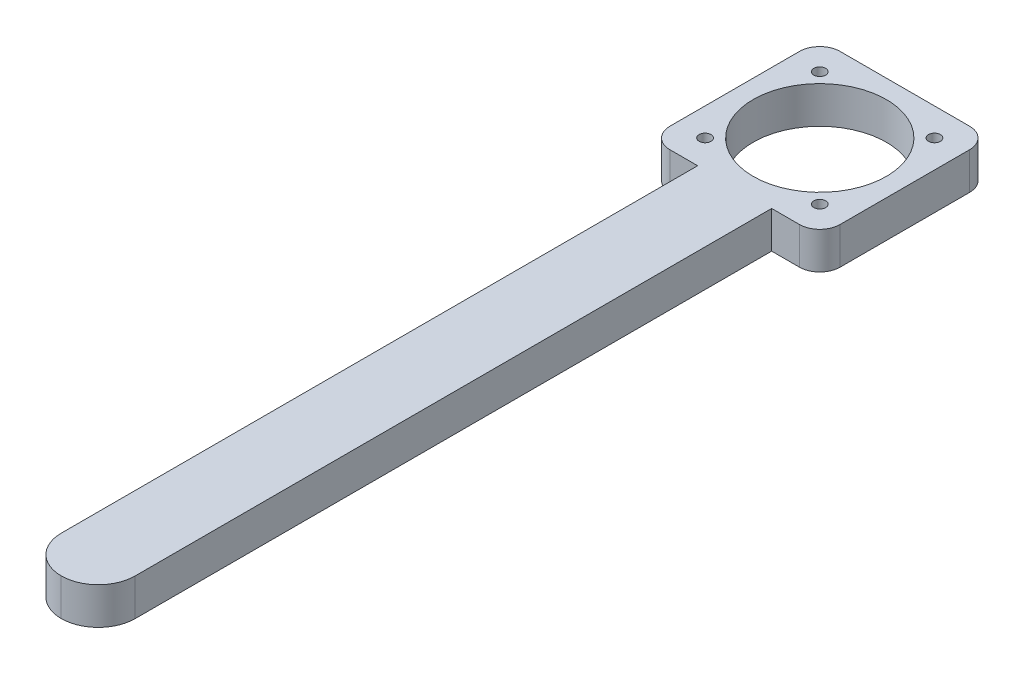
from build123d import *

# Parameters (mm, degrees)
SKETCH_2_W          = 46
SKETCH_2_H          = 46
SKETCH_2_R          = 18
EXTRUDE_1_DEPTH     = 10
FILLET_1_R          = 5.5
SKETCH_3_R          = 1.6
CUT_EXTRUDE_1_DEPTH = 35.029399054
SKETCH_4_W          = 20
SKETCH_4_H          = 182
EXTRUDE_2_DEPTH     = 10
FILLET_2_R          = 10


with BuildPart() as part:
    # 草图2 → 凸台-拉伸1 (new body)
    with BuildSketch(Plane(origin=(0, 0, 0), x_dir=(1, 0, 0), z_dir=(0, 1, 0))):
        Rectangle(SKETCH_2_W, SKETCH_2_H)
        with Locations(Location((0, 0, 0), (0, 0, 270))):
            Circle(SKETCH_2_R, mode=Mode.SUBTRACT)
    extrude(amount=EXTRUDE_1_DEPTH)

    # 圆角1
    fillet_1_edges = [part.edges().sort_by_distance(p)[0] for p in [
        (23, 5, 23),
        (-23, 5, 23),
        (-23, 5, -23),
        (23, 5, -23),
    ]]
    fillet(fillet_1_edges, radius=FILLET_1_R)

    # 草图3 → 切除-拉伸1 (cut, through all)
    with BuildSketch(Plane(origin=(0, 10, 0), x_dir=(1, 0, 0), z_dir=(0, 1, 0))):
        with Locations(Location((-15.5, 15.5, 0), (0, 0, 270))):
            Circle(SKETCH_3_R)
        with Locations(Location((15.5, 15.5, 0), (0, 0, 270))):
            Circle(SKETCH_3_R)
        with Locations(Location((-15.5, -15.5, 0), (0, 0, 270))):
            Circle(SKETCH_3_R)
        with Locations(Location((15.5, -15.5, 0), (0, 0, 270))):
            Circle(SKETCH_3_R)
    extrude(amount=-CUT_EXTRUDE_1_DEPTH, mode=Mode.SUBTRACT)

    # 草图4 → 凸台-拉伸2 (add)
    with BuildSketch(Plane(origin=(0, 10, 0), x_dir=(1, 0, 0), z_dir=(0, 1, 0))):
        with Locations((0, -114)):
            Rectangle(SKETCH_4_W, SKETCH_4_H)
    extrude(amount=-EXTRUDE_2_DEPTH)

    # 圆角2
    fillet_2_edges = [part.edges().sort_by_distance(p)[0] for p in [
        (-10, 5, 205),
        (10, 5, 205),
    ]]
    fillet(fillet_2_edges, radius=FILLET_2_R - 0.0001)  # a hair under: the kernel refuses the full size


solid = part.part
